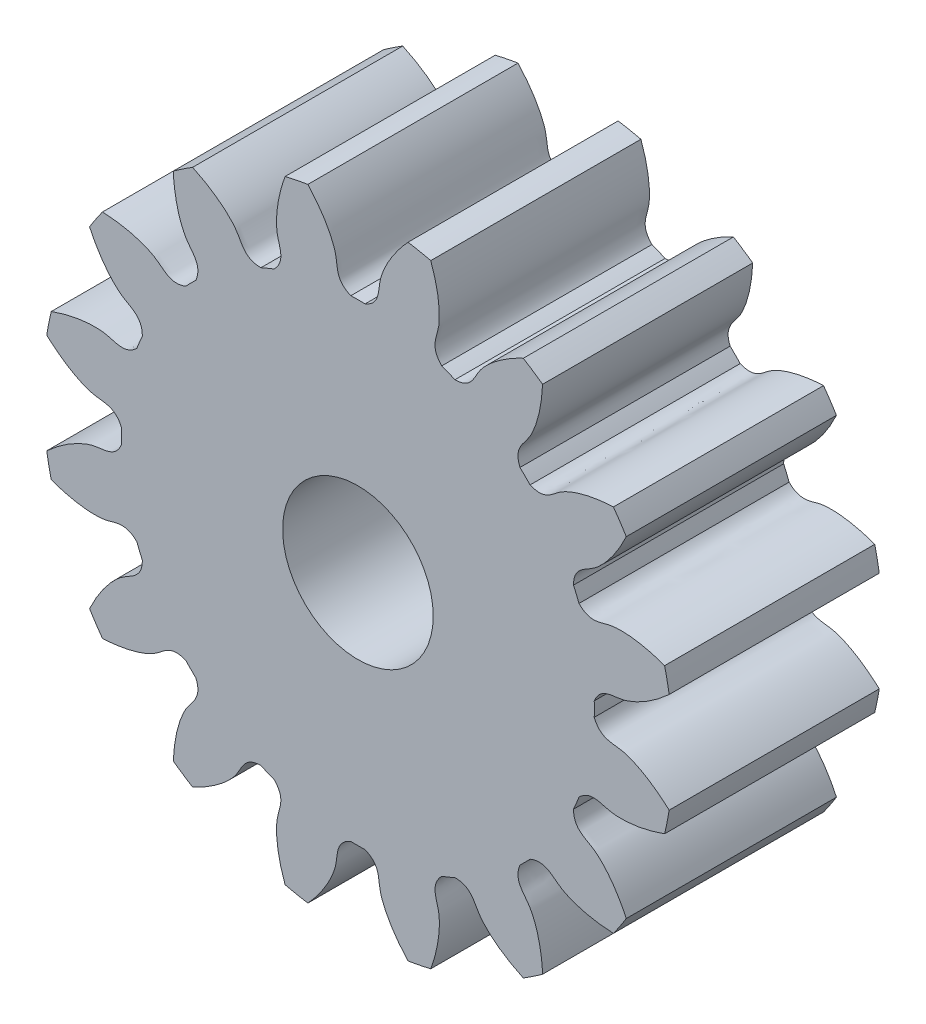
from build123d import *

# Parameters (mm, degrees)
SKETCH_1_R               = 4.5
EXTRUDE_1_DEPTH          = 3
CUT_EXTRUDE_1_DEPTH      = 8.03562364
PATTERN_CIRCULAR_1_COUNT = 16
SKETCH_4_R               = 1.075
CUT_EXTRUDE_2_DEPTH      = 10


with BuildPart() as part:
    # 草图1 → 凸台-拉伸1 (new body)
    with BuildSketch(Plane.XY):
        Circle(SKETCH_1_R)
    extrude(amount=EXTRUDE_1_DEPTH)

    # 草图2 → 切除-拉伸1 (cut, through all)
    with BuildSketch(Plane.XY):
        with BuildLine():
            ThreePointArc((0.101680395, 3.373467963), (0, 3.375), (-0.101680395, 3.373467963))
            add(Edge.make_bspline(
                [(-0.101680395, 3.373467963), (-0.320919735, 3.465061005), (-0.284660598, 3.635349809), (-0.322390644, 3.793404963), (-0.325601394, 3.80577545), (-0.329466049, 3.819526781), (-0.334039479, 3.834637453), (-0.339377888, 3.851083952), (-0.345536205, 3.868841182), (-0.352568839, 3.887882349), (-0.360529384, 3.908179024), (-0.369470654, 3.92970115), (-0.379444617, 3.952417062), (-0.390502356, 3.976293514), (-0.402694025, 4.001295699), (-0.416068812, 4.02738727), (-0.430674889, 4.054530373), (-0.446559381, 4.082685666), (-0.463768319, 4.111812348), (-0.482346604, 4.141868189), (-0.502337967, 4.172809557), (-0.523784931, 4.20459145), (-0.546728776, 4.237167525), (-0.571209498, 4.270490132), (-0.597265778, 4.304510345), (-0.624934946, 4.339177997), (-0.654252942, 4.374441713), (-0.685254293, 4.41024895), (-0.717972069, 4.446546028), (-0.752437861, 4.483278171), (-0.788681746, 4.520389541), (-0.826732258, 4.557823283), (-0.866616358, 4.595521557), (-0.90835941, 4.633425586), (-0.951985152, 4.67147569), (-0.99751567, 4.709611333), (-1.044971373, 4.747771162), (-1.094370973, 4.785893051), (-1.145731456, 4.823914147), (-1.199068069, 4.861770908), (-1.254394289, 4.899399156), (-1.311721817, 4.936734114), (-1.371060539, 4.97371046), (-1.453732402, 5.022959339), (-1.517494148, 5.058370721), (-1.560889991, 5.081371225)],
                knots=[0, 0, 0, 0, 0.200958108, 0.205848205, 0.211390316, 0.217584439, 0.224430575, 0.231928724, 0.240078886, 0.248881062, 0.25833525, 0.268441451, 0.279199665, 0.290609892, 0.302672132, 0.315386384, 0.32875265, 0.342770929, 0.357441221, 0.372763526, 0.388737843, 0.405364174, 0.422642518, 0.440572874, 0.459155244, 0.478389626, 0.498276022, 0.51881443, 0.540004852, 0.561847286, 0.584341734, 0.607488194, 0.631286667, 0.655737153, 0.680839653, 0.706594165, 0.73300069, 0.760059228, 0.787769779, 0.816132343, 0.84514692, 0.87481351, 0.905132113, 0.936102729, 1, 1, 1, 1], degree=3))
            ThreePointArc((-1.560889991, 5.081371225), (0, 5.315704195), (1.560889991, 5.081371225))
            add(Edge.make_bspline(
                [(0.101680395, 3.373467963), (0.320919735, 3.465061005), (0.284660598, 3.635349809), (0.322390644, 3.793404963), (0.325601394, 3.80577545), (0.329466049, 3.819526781), (0.334039479, 3.834637453), (0.339377888, 3.851083952), (0.345536205, 3.868841182), (0.352568839, 3.887882349), (0.360529384, 3.908179024), (0.369470654, 3.92970115), (0.379444617, 3.952417062), (0.390502356, 3.976293514), (0.402694025, 4.001295699), (0.416068812, 4.02738727), (0.430674889, 4.054530373), (0.446559381, 4.082685666), (0.463768319, 4.111812348), (0.482346604, 4.141868189), (0.502337967, 4.172809557), (0.523784931, 4.20459145), (0.546728776, 4.237167525), (0.571209498, 4.270490132), (0.597265778, 4.304510345), (0.624934946, 4.339177997), (0.654252942, 4.374441713), (0.685254293, 4.41024895), (0.717972069, 4.446546028), (0.752437861, 4.483278171), (0.788681746, 4.520389541), (0.826732258, 4.557823283), (0.866616358, 4.595521557), (0.90835941, 4.633425586), (0.951985152, 4.67147569), (0.99751567, 4.709611333), (1.044971373, 4.747771162), (1.094370973, 4.785893051), (1.145731456, 4.823914147), (1.199068069, 4.861770908), (1.254394289, 4.899399156), (1.311721817, 4.936734114), (1.371060539, 4.97371046), (1.453732402, 5.022959339), (1.517494148, 5.058370721), (1.560889991, 5.081371225)],
                knots=[0, 0, 0, 0, 0.200958108, 0.205848205, 0.211390316, 0.217584439, 0.224430575, 0.231928724, 0.240078886, 0.248881062, 0.25833525, 0.268441451, 0.279199665, 0.290609892, 0.302672132, 0.315386384, 0.32875265, 0.342770929, 0.357441221, 0.372763526, 0.388737843, 0.405364174, 0.422642518, 0.440572874, 0.459155244, 0.478389626, 0.498276022, 0.51881443, 0.540004852, 0.561847286, 0.584341734, 0.607488194, 0.631286667, 0.655737153, 0.680839653, 0.706594165, 0.73300069, 0.760059228, 0.787769779, 0.816132343, 0.84514692, 0.87481351, 0.905132113, 0.936102729, 1, 1, 1, 1], degree=3))
        make_face()
    cut_extrude_1 = extrude(amount=CUT_EXTRUDE_1_DEPTH, mode=Mode.SUBTRACT)

    # 阵列(圆周)1: 切除-拉伸1 ×16 about axis
    pattern_circular_1_axis = Axis((0, 0, 3), (0, 0, -1))
    for i in range(1, PATTERN_CIRCULAR_1_COUNT):
        add(cut_extrude_1.rotate(pattern_circular_1_axis, i * 360 / PATTERN_CIRCULAR_1_COUNT), mode=Mode.SUBTRACT)

    # 草图4 → 切除-拉伸2 (cut)
    with BuildSketch(Plane.XY.offset(3)):
        Circle(SKETCH_4_R)
    extrude(amount=-CUT_EXTRUDE_2_DEPTH, mode=Mode.SUBTRACT)


solid = part.part
